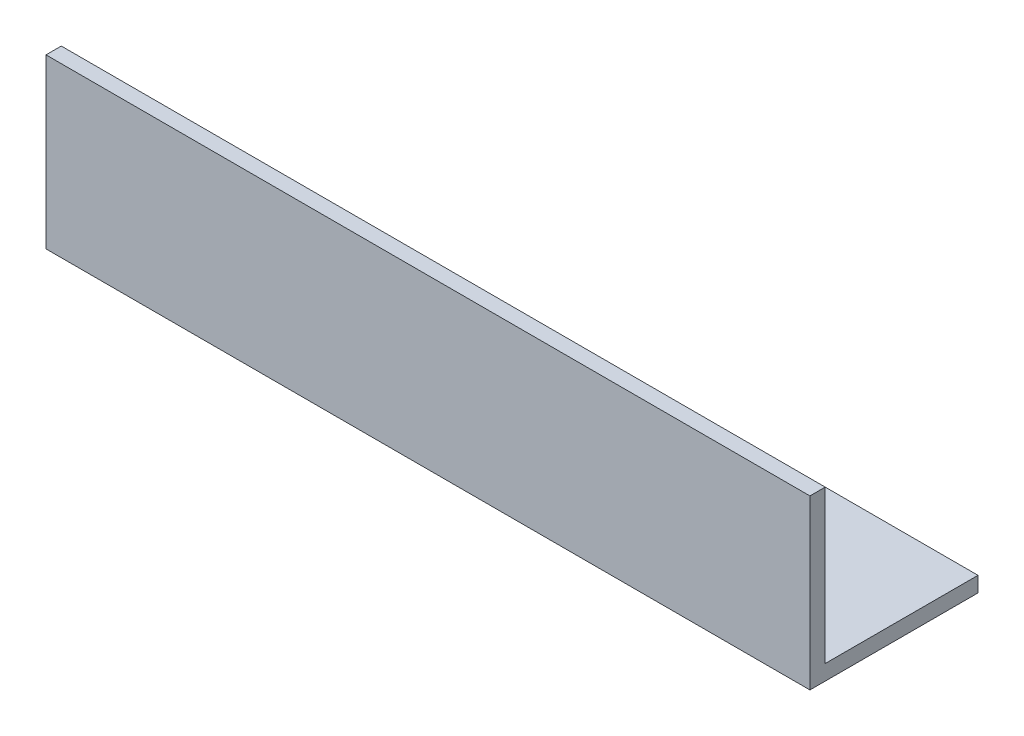
from build123d import *

# Parameters (mm, degrees)
EXTRUDE_1_DEPTH     = 150
SKETCH_2_R          = 5
CUT_EXTRUDE_1_DEPTH = 157.489616269


with BuildPart() as part:
    # Эскиз1 → Вытянуть-Тонкостенный1 (new body)
    with BuildSketch(Plane(origin=(0, 0, 0), x_dir=(0, 0, -1), z_dir=(1, 0, 0))):
        Polygon((30, 0), (0, 0), (0, 30), (-3, 30), (-3, -3), (30, -3), align=None)
    extrude(amount=EXTRUDE_1_DEPTH)

    # Эскиз2 → Вырез-Вытянуть1 (cut, through all)
    with BuildSketch(Plane.XZ.offset(3)):
        with Locations((130, -9)):
            Circle(SKETCH_2_R)
        with Locations((100, -9)):
            Circle(SKETCH_2_R)
        with Locations((50, -9)):
            Circle(SKETCH_2_R)
        with Locations((20, -9)):
            Circle(SKETCH_2_R)
    extrude(amount=-CUT_EXTRUDE_1_DEPTH, mode=Mode.SUBTRACT)


solid = part.part
